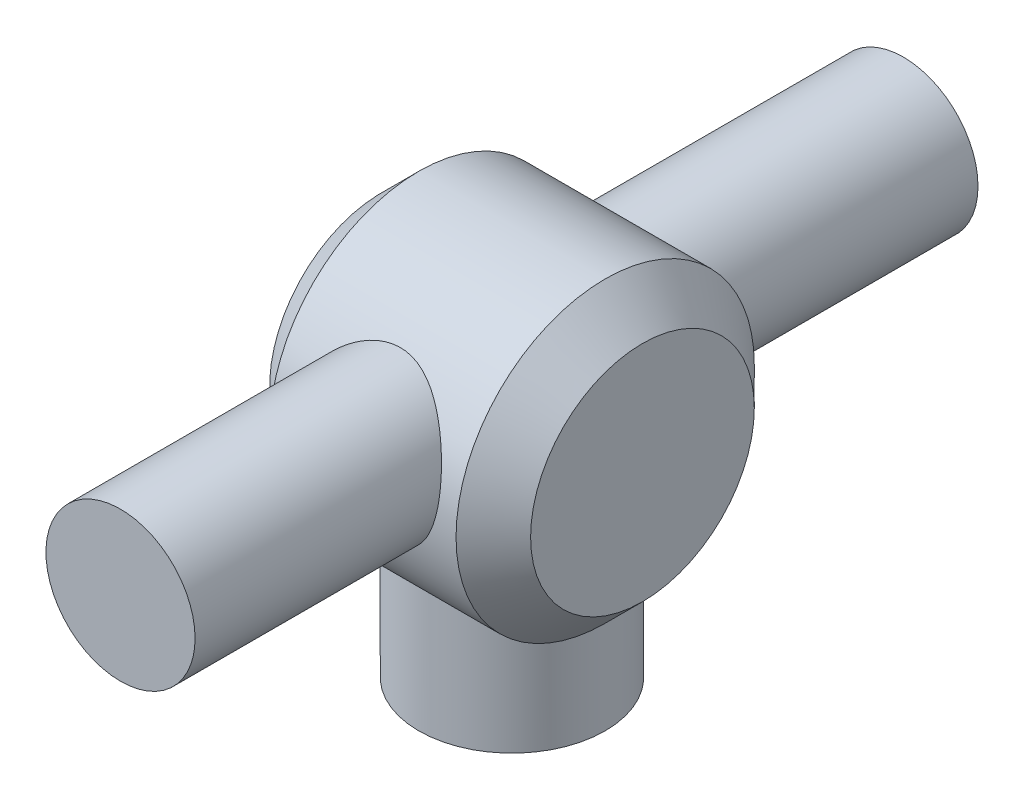
from build123d import *

# Parameters (mm, degrees)
SKETCH1_R           = 5
BOSS_EXTRUDE1_DEPTH = 10
SKETCH2_R           = 8
BOSS_EXTRUDE2_DEPTH = 7
SKETCH3_R           = 4
BOSS_EXTRUDE3_DEPTH = 21
CHAMFER1_SIZE       = 2


with BuildPart() as part:
    # Sketch1 → Boss-Extrude1 (new body)
    with BuildSketch(Plane(origin=(0, 0, 0), x_dir=(1, 0, 0), z_dir=(0, 1, 0))):
        with Locations(Location((0, 0, 0), (0, 0, 270))):
            Circle(SKETCH1_R)
    extrude(amount=BOSS_EXTRUDE1_DEPTH)

    # Sketch2 → Boss-Extrude2 (add, symmetric)
    with BuildSketch(Plane(origin=(0, 0, 0), x_dir=(0, 0, -1), z_dir=(1, 0, 0))):
        with Locations((0, 13)):
            Circle(SKETCH2_R)
    extrude(amount=BOSS_EXTRUDE2_DEPTH, both=True)

    # Sketch3 → Boss-Extrude3 (add, symmetric)
    with BuildSketch(Plane.XY):
        with Locations(Location((0, 14.305, 0), (0, 0, 180))):
            Circle(SKETCH3_R)
    extrude(amount=BOSS_EXTRUDE3_DEPTH, both=True)

    # Chamfer1
    chamfer1_edges = [part.edges().sort_by_distance(p)[0] for p in [
        (-7, 13, 8),
        (7, 13, 8),
    ]]
    chamfer(chamfer1_edges, length=CHAMFER1_SIZE - 0.0001)  # a hair under: the kernel refuses the full size


solid = part.part
